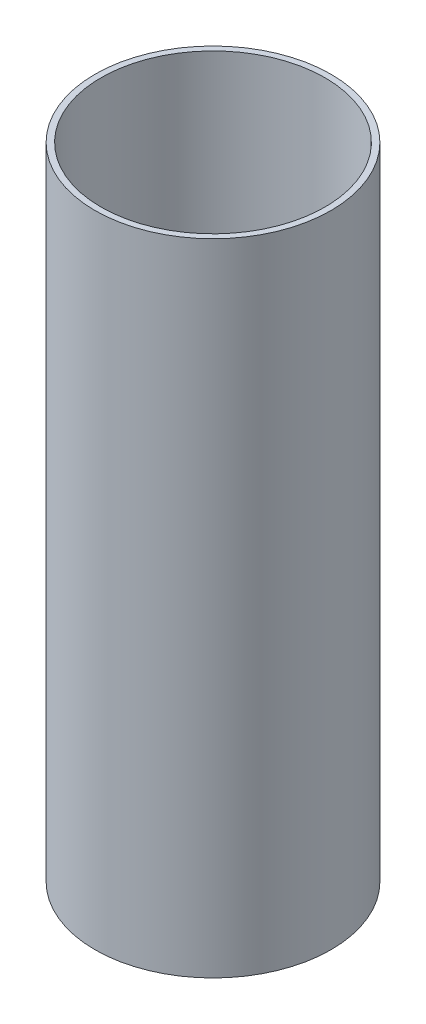
from build123d import *

# Parameters (mm, degrees)
SKETCH1_R           = 93.6625
SKETCH1_R_2         = 88.9
BOSS_EXTRUDE1_DEPTH = 254


with BuildPart() as part:
    # Sketch1 → Boss-Extrude1 (new, symmetric)
    with BuildSketch(Plane(origin=(0, 0, 0), x_dir=(1, 0, 0), z_dir=(0, 1, 0))):
        Circle(SKETCH1_R)
        Circle(SKETCH1_R_2, mode=Mode.SUBTRACT)
    extrude(amount=BOSS_EXTRUDE1_DEPTH, both=True)


solid = part.part
